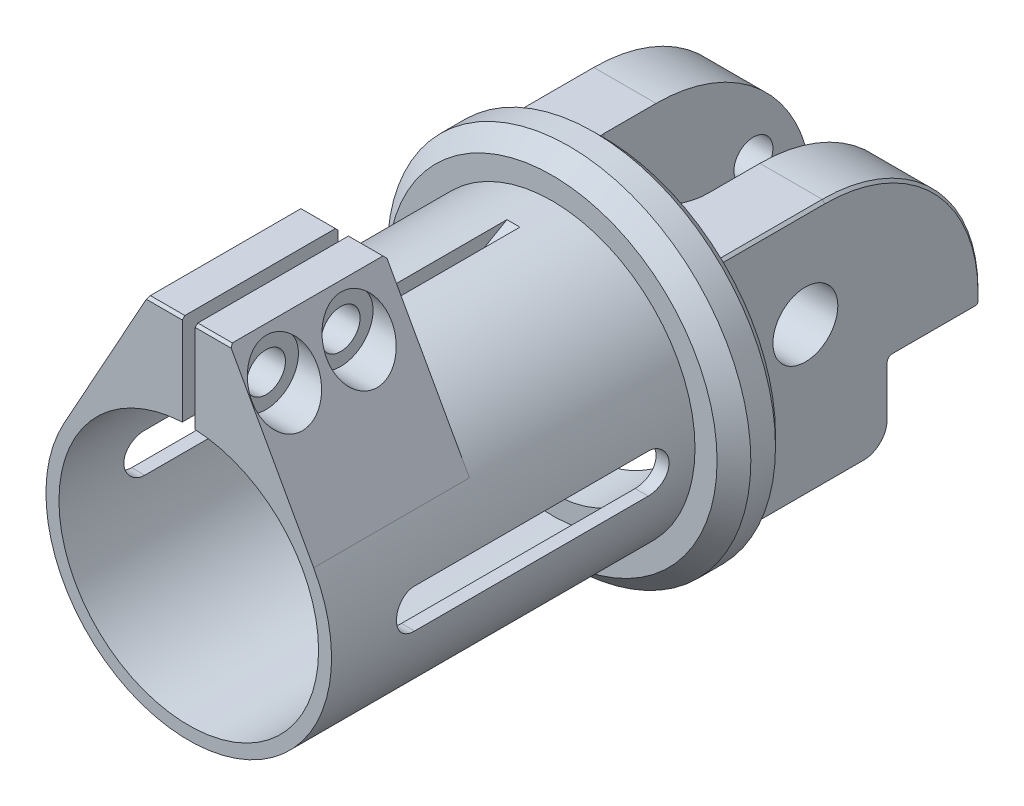
from build123d import *

# Parameters (mm, degrees)
SKETCH1_R                                           = 14
BOSS_EXTRUDE1_DEPTH                                 = 4
SKETCH2_R                                           = 8.5
CUT_EXTRUDE1_DEPTH                                  = 21.199009877
SKETCH3_R                                           = 11
BOSS_EXTRUDE2_DEPTH                                 = 28
SKETCH4_R                                           = 10
CUT_EXTRUDE2_DEPTH                                  = 28
BOSS_EXTRUDE3_START                                 = -12
BOSS_EXTRUDE3_DEPTH                                 = 12
BOSS_EXTRUDE4_DEPTH                                 = 9
BOSS_EXTRUDE4_DEPTH_BACK                            = 9
CUT_EXTRUDE7_START                                  = -19
CUT_EXTRUDE7_DEPTH                                  = 19
CUT_EXTRUDE8_REACH                                  = 48.701
CUT_EXTRUDE8_END_RADIUS                             = 10
SKETCH8_W                                           = 1
SKETCH8_H                                           = 21.539335767
CUT_EXTRUDE9_START                                  = -4
SKETCH9_R                                           = 8.5
CUT_EXTRUDE9_DEPTH                                  = 4
CHAMFER1_SIZE                                       = 1.3
CHAMFER2_SIZE                                       = 0.8
CHAMFER4_SIZE                                       = 0.2
CHAMFER5_SIZE                                       = 0.2
CHAMFER6_SIZE                                       = 3.464101615
CHAMFER6_SIZE_2                                     = 2
CUT_EXTRUDE10_DEPTH                                 = 39.845849199
CUT_EXTRUDE10_DEPTH_BACK                            = 39.845849199
CUT_EXTRUDE12_DEPTH                                 = 39.845849281
CUT_EXTRUDE12_DEPTH_BACK                            = 39.845849281
SKETCH11_R                                          = 2.5
CSK_FOR_M3_COUNTERSUNK_FLAT_HEAD_SCREW1_D           = 3
CSK_FOR_M3_COUNTERSUNK_FLAT_HEAD_SCREW1_DEPTH       = 5
CSK_FOR_M3_COUNTERSUNK_FLAT_HEAD_SCREW1_CSINK_D     = 4
CSK_FOR_M3_COUNTERSUNK_FLAT_HEAD_SCREW1_CSINK_ANGLE = 90
CSK_FOR_M3_COUNTERSUNK_FLAT_HEAD_SCREW1_TIP         = 0.901290929
CUT_EXTRUDE13_DEPTH                                 = 39.845849281
CUT_EXTRUDE13_DEPTH_BACK                            = 39.845849281
SKETCH15_R                                          = 1.5
SKETCH16_R                                          = 2.5
CUT_EXTRUDE14_DEPTH                                 = 6.6


# Read off the part's stored shape, not the designer's step: Cut-Extrude7
with BuildPart() as part:
    # Sketch1 → Boss-Extrude1 (new body)
    with BuildSketch(Plane.XY):
        Circle(SKETCH1_R)
    extrude(amount=BOSS_EXTRUDE1_DEPTH)

    # Sketch2 → Cut-Extrude1 (cut, through all)
    with BuildSketch(Plane(origin=(0, 0, 0), x_dir=(-1, 0, 0), z_dir=(0, 0, -1))):
        Circle(SKETCH2_R)
    extrude(amount=-CUT_EXTRUDE1_DEPTH, mode=Mode.SUBTRACT)

    # Sketch3 → Boss-Extrude2 (add)
    with BuildSketch(Plane.XY.offset(4)):
        Circle(SKETCH3_R)
    extrude(amount=BOSS_EXTRUDE2_DEPTH)

    # Sketch4 → Cut-Extrude2 (cut)
    with BuildSketch(Plane.XY.offset(32)):
        Circle(SKETCH4_R)
    extrude(amount=-CUT_EXTRUDE2_DEPTH, mode=Mode.SUBTRACT)

    # Sketch5 → Boss-Extrude3 (add)
    with BuildSketch(Plane.XY.offset(32).offset(BOSS_EXTRUDE3_START)):
        with BuildLine():
            Line((3.158488565, 17), (-3.158488565, 17))
            Line((-3.158488565, 17), (-9.622511389, 5.329847518))
            ThreePointArc((-9.622511389, 5.329847518), (0, 11), (9.622511389, 5.329847518))
            Line((9.622511389, 5.329847518), (3.158488565, 17))
        make_face()
    extrude(amount=BOSS_EXTRUDE3_DEPTH)

    # Sketch6 → Boss-Extrude4 (add, two sides: drawn at the far end of the back side and taken through both)
    with BuildSketch(Plane(origin=(0, 0, 0), x_dir=(0, 0, -1), z_dir=(1, 0, 0)).offset(-BOSS_EXTRUDE4_DEPTH_BACK)):
        with BuildLine():
            Line((0, 9.5), (0, -9.5))
            Line((0, -9.5), (11, -9.5))
            ThreePointArc((11, -9.5), (12.414213562, -8.914213562), (13, -7.5))
            Line((13, -7.5), (13, -3.7))
            ThreePointArc((13, -3.7), (13.058578644, -3.558578644), (13.2, -3.5))
            Line((13.2, -3.5), (19.6, -3.5))
            ThreePointArc((19.6, -3.5), (19.882842712, -3.382842712), (20, -3.1))
            Line((20, -3.1), (20, -2.5))
            ThreePointArc((20, -2.5), (16.485281374, 5.985281374), (8, 9.5))
            Line((8, 9.5), (0, 9.5))
        make_face()
    extrude(amount=BOSS_EXTRUDE4_DEPTH + BOSS_EXTRUDE4_DEPTH_BACK)

    # Cut-Extrude7 outline → Cut-Extrude7 (cut)
    with BuildSketch(Plane(origin=(0, 9.5, 0), x_dir=(1, 0, 0), z_dir=(0, 1, 0)).offset(CUT_EXTRUDE7_START)):
        with BuildLine():
            ThreePointArc((-4, 4.0001), (0, 0.0001), (4, 4.0001))
            Line((4, 4.0001), (4, 20))
            Line((4, 20), (-4, 20))
            Line((-4, 20), (-4, 4.0001))
        make_face()
    extrude(amount=CUT_EXTRUDE7_DEPTH, mode=Mode.SUBTRACT)

    # Cut-Extrude8: up to this cylinder (the profile starts outside it)
    cut_extrude8_end = Plane(origin=(0, 0, 21.230332), z_dir=(0, 0, 1)) * Cylinder(CUT_EXTRUDE8_END_RADIUS, 118.402, mode=Mode.PRIVATE)
    # Sketch8 → Cut-Extrude8 (cut, up to the surface)
    with BuildSketch(Plane(origin=(0, 17, 0), x_dir=(1, 0, 0), z_dir=(0, 1, 0)), mode=Mode.PRIVATE) as cut_extrude8_sk1:
        with Locations((0, -21.230332117)):
            Rectangle(SKETCH8_W, SKETCH8_H)
    cut_extrude8_tool1 = extrude(cut_extrude8_sk1.sketch, amount=-CUT_EXTRUDE8_REACH, mode=Mode.PRIVATE) - cut_extrude8_end
    add(cut_extrude8_tool1.solids().sort_by_distance((0, 17, 21.230332))[0], mode=Mode.SUBTRACT)

    # Sketch9 → Cut-Extrude9 (cut)
    with BuildSketch(Plane.XY.offset(CUT_EXTRUDE9_START)):
        with Locations(Location((0, 0, 0), (0, 0, 180))):
            Circle(SKETCH9_R)
    extrude(amount=CUT_EXTRUDE9_DEPTH, mode=Mode.SUBTRACT)

    # Chamfer1
    chamfer1_edges = [part.edges().sort_by_distance(p)[0] for p in [
        (-14, 0, 4),
    ]]
    chamfer(chamfer1_edges, length=CHAMFER1_SIZE)

    # Chamfer2
    chamfer2_edges = [part.edges().sort_by_distance(p)[0] for p in [
        (-14, 0, 0),
    ]]
    chamfer(chamfer2_edges, length=CHAMFER2_SIZE)

    # Chamfer4
    chamfer4_edges = [part.edges().sort_by_distance(p)[0] for p in [
        (9, -3.382842712, -19.882842712),
        (-9, -3.5, -16.4),
        (9, -3.558578644, -13.058578644),
        (-9, -5.6, -13),
        (9, -8.914213562, -12.414213562),
        (-9, -9.5, -5.5),
        (-9, 9.5, -4),
        (-9, 5.985281374, -16.485281374),
        (-9, -2.8, -20),
        (-9, -3.382842712, -19.882842712),
        (-9, -3.558578644, -13.058578644),
        (-9, -8.914213562, -12.414213562),
        (9, -2.8, -20),
        (9, 5.985281374, -16.485281374),
        (9, 9.5, -4),
        (9, -9.5, -5.5),
        (9, -5.6, -13),
        (9, -3.5, -16.4),
    ]]
    chamfer(chamfer4_edges, length=CHAMFER4_SIZE)

    # Chamfer5
    chamfer5_edges = [part.edges().sort_by_distance(p)[0] for p in [
        (-1.829244283, 17, 20),
        (-1.829244283, 17, 32),
        (1.829244283, 17, 20),
        (1.829244283, 17, 32),
    ]]
    chamfer(chamfer5_edges, length=CHAMFER5_SIZE)

    # Chamfer6
    # the kernel refuses this chamfer: 3.464101615, 2 mm, written as the material it takes off along each edge
    with BuildSketch(Plane(origin=(0, 0, 10.460664233), x_dir=(-0.757967837141711, 0.6522919268691869, 0), z_dir=(-0.6522919268691869, -0.757967837141711, 0))) as chamfer6_piece_1_section:
        Polygon((11, CHAMFER6_SIZE), (11 - CHAMFER6_SIZE_2, 0), (11, 0), align=None)
    chamfer6_piece_1 = revolve(axis=Axis((0, 0, 10.460664233), (0, 0, -1)), revolution_arc=98.570745894, mode=Mode.PRIVATE)
    chamfer6_piece_1 = split(chamfer6_piece_1, bisect_by=Plane(origin=(-0.5, 10.551597033, 9.113518596), z_dir=(1, 0, 0)), keep=Keep.TOP, mode=Mode.PRIVATE)
    chamfer6_piece_1 = split(chamfer6_piece_1, bisect_by=Plane(origin=(0.5, 10.551597033, 9.113518596), z_dir=(-1, 0, 0)), keep=Keep.TOP, mode=Mode.PRIVATE)
    add(chamfer6_piece_1, mode=Mode.SUBTRACT)

    # Sketch10 → Cut-Extrude10 (cut, two sides: drawn at the far end of the back side and taken through both)
    with BuildSketch(Plane(origin=(0, 0, 0), x_dir=(0, 0, -1), z_dir=(1, 0, 0)).offset(-CUT_EXTRUDE10_DEPTH_BACK)):
        with BuildLine():
            Line((-25.5, 1.5), (-7.5, 1.5))
            ThreePointArc((-7.5, 1.5), (-6, 0), (-7.5, -1.5))
            Line((-7.5, -1.5), (-25.5, -1.5))
            ThreePointArc((-25.5, -1.5), (-27, 0), (-25.5, 1.5))
        make_face()
    extrude(amount=CUT_EXTRUDE10_DEPTH + CUT_EXTRUDE10_DEPTH_BACK, mode=Mode.SUBTRACT)

    # Sketch11 → Cut-Extrude12 (cut, two sides: drawn at the far end of the back side and taken through both)
    with BuildSketch(Plane(origin=(0, 0, 0), x_dir=(0, 0, -1), z_dir=(1, 0, 0)).offset(-CUT_EXTRUDE12_DEPTH_BACK)):
        with Locations((6.50011, 2)):
            Circle(SKETCH11_R)
    extrude(amount=CUT_EXTRUDE12_DEPTH + CUT_EXTRUDE12_DEPTH_BACK, mode=Mode.SUBTRACT)

    # CSK for M3 Countersunk Flat Head Screw1
    with Locations(Plane.ZY.offset(9)):
        with Locations((-6.50011, -6), (-15.50011, 2)):
            CounterSinkHole(CSK_FOR_M3_COUNTERSUNK_FLAT_HEAD_SCREW1_D / 2, CSK_FOR_M3_COUNTERSUNK_FLAT_HEAD_SCREW1_CSINK_D / 2, depth=CSK_FOR_M3_COUNTERSUNK_FLAT_HEAD_SCREW1_DEPTH, counter_sink_angle=CSK_FOR_M3_COUNTERSUNK_FLAT_HEAD_SCREW1_CSINK_ANGLE)
            with Locations((0, 0, -(CSK_FOR_M3_COUNTERSUNK_FLAT_HEAD_SCREW1_DEPTH + CSK_FOR_M3_COUNTERSUNK_FLAT_HEAD_SCREW1_TIP / 2))):  # 118° drill point
                Cone(0, CSK_FOR_M3_COUNTERSUNK_FLAT_HEAD_SCREW1_D / 2, CSK_FOR_M3_COUNTERSUNK_FLAT_HEAD_SCREW1_TIP, mode=Mode.SUBTRACT)

    # Sketch15 → Cut-Extrude13 (cut, two sides: drawn at the far end of the back side and taken through both)
    with BuildSketch(Plane(origin=(0, 0, 0), x_dir=(0, 0, -1), z_dir=(1, 0, 0)).offset(-CUT_EXTRUDE13_DEPTH_BACK)):
        with Locations(Location((-29.45, 13.994315244, 0), (0, 0, 90))):
            Circle(SKETCH15_R)
        with Locations(Location((-23.7, 13.994315244, 0), (0, 0, 90))):
            Circle(SKETCH15_R)
    extrude(amount=CUT_EXTRUDE13_DEPTH + CUT_EXTRUDE13_DEPTH_BACK, mode=Mode.SUBTRACT)

    # Sketch16 → Cut-Extrude14 (cut)
    with BuildSketch(Plane(origin=(10, 0, 0), x_dir=(0, 0, -1), z_dir=(1, 0, 0))):
        with Locations((-29.45, 13.994315244)):
            Circle(SKETCH16_R)
        with Locations((-23.7, 13.994315244)):
            Circle(SKETCH16_R)
    extrude(amount=-CUT_EXTRUDE14_DEPTH, mode=Mode.SUBTRACT)


solid = part.part
